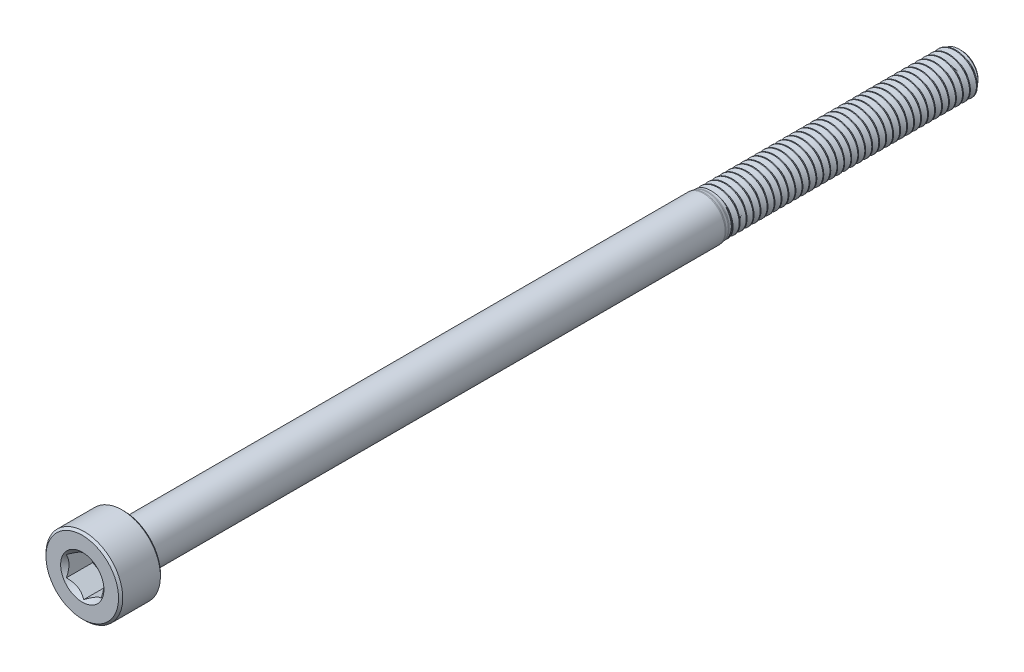
from build123d import *

# Parameters (mm, degrees)
CUT_EXTRUDE1_DEPTH     = 2
SKETCH4_R              = 1.551628848
CUT_EXTRUDE2_DEPTH     = 1.5
CUT_EXTRUDE2_DRAFT     = -45
SPLIT1_SURFACE_1_BACK  = 64.478
SPLIT1_SURFACE_1_DEPTH = 128.956
SPLIT1_SURFACE_2_BACK  = 64.478
SPLIT1_SURFACE_2_DEPTH = 128.956
CUT_SWEEP1_PITCH       = 0.5
CUT_SWEEP1_TO          = 18


with BuildPart() as part:
    # Sketch2 → Revolve1 (revolve)
    with BuildSketch(Plane(origin=(0, 0, 0), x_dir=(0, 0, -1), z_dir=(1, 0, 0))):
        with BuildLine():
            Line((-31.5, 0), (-31.5, 2.6))
            Line((-31.5, 2.6), (-31.35, 2.75))
            Line((-31.35, 2.75), (-28.65, 2.75))
            Line((-28.65, 2.75), (-28.5, 2.6))
            Line((-28.5, 2.6), (-28.5, 1.704126588))
            ThreePointArc((-28.5, 1.704126588), (-28.456066017, 1.598060571), (-28.35, 1.554126588))
            Line((-28.35, 1.554126588), (13.003452992, 1.554126588))
            ThreePointArc((13.003452992, 1.554126588), (13.040209419, 1.55232086), (13.076611862, 1.546921068))
            Line((13.076611862, 1.546921068), (13.276275406, 1.50720552))
            ThreePointArc((13.276275406, 1.50720552), (13.312677849, 1.501805727), (13.349434276, 1.5))
            Line((13.349434276, 1.5), (31.175240474, 1.5))
            Line((31.175240474, 1.5), (31.5, 1.175240474))
            Line((31.5, 1.175240474), (31.5, 0))
            Line((31.5, 0), (-31.5, 0))
        make_face()
    revolve(axis=Axis((0, 0, -31.5), (0, 0, 1)))

    # Sketch3 → Cut-Extrude1 (cut)
    with BuildSketch(Plane.XY.offset(31.5)):
        Polygon((1.25, -0.721687836), (1.25, 0.721687836), (0, 1.443375673), (-1.25, 0.721687836), (-1.25, -0.721687836), (0, -1.443375673), align=None)
    extrude(amount=-CUT_EXTRUDE1_DEPTH, mode=Mode.SUBTRACT)


with BuildPart() as cut_extrude2_tool:
    # Sketch4 → Cut-Extrude2 (with draft: the straight prism first)
    with BuildSketch(Plane.XY.offset(31.5)):
        Circle(SKETCH4_R)
    extrude(amount=-CUT_EXTRUDE2_DEPTH)
    # Cut-Extrude2: the draft: its side faces are tilted about the plane it starts from
    cut_extrude2_sides = [cut_extrude2_tool.faces().sort_by_distance(p)[0] for p in [
        (-1.551628848, 0, 30.75),
    ]]
    draft(cut_extrude2_sides, Plane.XY.offset(31.5), CUT_EXTRUDE2_DRAFT)


with BuildPart() as part_1:
    add(part.part)

    # Cut-Extrude2: cut by cut_extrude2_tool
    add(cut_extrude2_tool.part, mode=Mode.SUBTRACT)


with BuildPart() as body_2:
    # Split1: the piece behind the surface
    add(part_1.part)
    # Split1 surface: a surface, the sketch's curves swept straight by 128.956 mm
    with BuildLine(Plane(origin=(0, 0, 0), x_dir=(0, 0, -1), z_dir=(1, 0, 0)).offset(-SPLIT1_SURFACE_1_BACK), mode=Mode.PRIVATE) as split1_surface_1_path:
        Line((13.5, -1.5), (13.5, 1.5))
    split1_surface_1 = Shell.extrude(split1_surface_1_path.wire(), (1 * SPLIT1_SURFACE_1_DEPTH, 0 * SPLIT1_SURFACE_1_DEPTH, 0 * SPLIT1_SURFACE_1_DEPTH))
    split(bisect_by=split1_surface_1, keep=Keep.BOTTOM)

    # Cut-Sweep1: arcs per turn and ends read off the stored shape
    # Cut-Sweep1: the profile of Sketch7 screwed along a right-hand helix through 37 turns, 6 arcs to a turn; built about Z, then put on its axis
    cut_sweep1_z = Axis((0, 0, 0), (0, 0, 1))
    cut_sweep1_corners = [(1.527063294, 0, 0.015625), (1.527063294, 0, -0.453125), (1.175240474, 0, -0.25), (1.175240474, 0, -0.1875)]
    with BuildLine(mode=Mode.PRIVATE) as cut_sweep1_profile:
        Line(cut_sweep1_corners[0], cut_sweep1_corners[1])
        Line(cut_sweep1_corners[1], cut_sweep1_corners[2])
        Line(cut_sweep1_corners[2], cut_sweep1_corners[3])
        Line(cut_sweep1_corners[3], cut_sweep1_corners[0])
    cut_sweep1_cap = Face(cut_sweep1_profile.wire())
    cut_sweep1_turn_angles = [0, 30, 60, 90, 120, 150, 180, 210, 240, 270, 300, 330, 360]
    cut_sweep1_turn_weights = [1, 0.8660254037844387, 1, 0.8660254037844387, 1, 0.8660254037844387, 1, 0.8660254037844387, 1, 0.8660254037844387, 1, 0.8660254037844387, 1]
    cut_sweep1_turn_rails = [Edge.make_bspline([Vector(p[0], p[1], 0).rotate(cut_sweep1_z, cut_sweep1_turn_angles[k]) / cut_sweep1_turn_weights[k] + Vector(0, 0, p[2] + CUT_SWEEP1_PITCH * cut_sweep1_turn_angles[k] / 360) for k in range(13)], [0, 0, 0, 1, 1, 2, 2, 3, 3, 4, 4, 5, 5, 6, 6, 6], 2, cut_sweep1_turn_weights) for p in cut_sweep1_corners]
    cut_sweep1_turn_sides = [Face.make_surface_from_curves(cut_sweep1_turn_rails[p[0]], cut_sweep1_turn_rails[p[1]]) for p in [(0, 1), (1, 2), (2, 3), (3, 0)]]
    cut_sweep1 = Plane(origin=(0, 0, -31.5), x_dir=(0, 1, 0), z_dir=(0, 0, 1)) * split(Solid(Shell([*[p.moved(Location((0, 0, CUT_SWEEP1_PITCH * i))) for i in range(37) for p in cut_sweep1_turn_sides], cut_sweep1_cap, cut_sweep1_cap.rotate(cut_sweep1_z, 13320).moved(Location((0, 0, CUT_SWEEP1_PITCH * 13320 / 360)))])), bisect_by=Plane.XY.offset(CUT_SWEEP1_TO), keep=Keep.BOTTOM, mode=Mode.PRIVATE)
    add(cut_sweep1, mode=Mode.SUBTRACT)


with BuildPart() as part_2:
    add(part_1.part)

    # Split1: split by a surface, the side it looks to stays
    # Split1 surface: a surface, the sketch's curves swept straight by 128.956 mm
    with BuildLine(Plane(origin=(0, 0, 0), x_dir=(0, 0, -1), z_dir=(1, 0, 0)).offset(-SPLIT1_SURFACE_2_BACK), mode=Mode.PRIVATE) as split1_surface_2_path:
        Line((13.5, -1.5), (13.5, 1.5))
    split1_surface_2 = Shell.extrude(split1_surface_2_path.wire(), (1 * SPLIT1_SURFACE_2_DEPTH, 0 * SPLIT1_SURFACE_2_DEPTH, 0 * SPLIT1_SURFACE_2_DEPTH))
    split(bisect_by=split1_surface_2, keep=Keep.TOP)

    add(body_2.part)  # Revolve2 merges body 2
    # Sketch8 → Revolve2 (revolve)
    with BuildSketch(Plane(origin=(0, 0, 0), x_dir=(0, 0, -1), z_dir=(1, 0, 0))):
        Polygon((-28.5, 0), (-28.5, 1.5), (13.5, 1.5), (14.366025404, 0), align=None)
    revolve(axis=Axis((0, 0, -14.366025404), (0, 0, 1)))


solid = part_2.part
